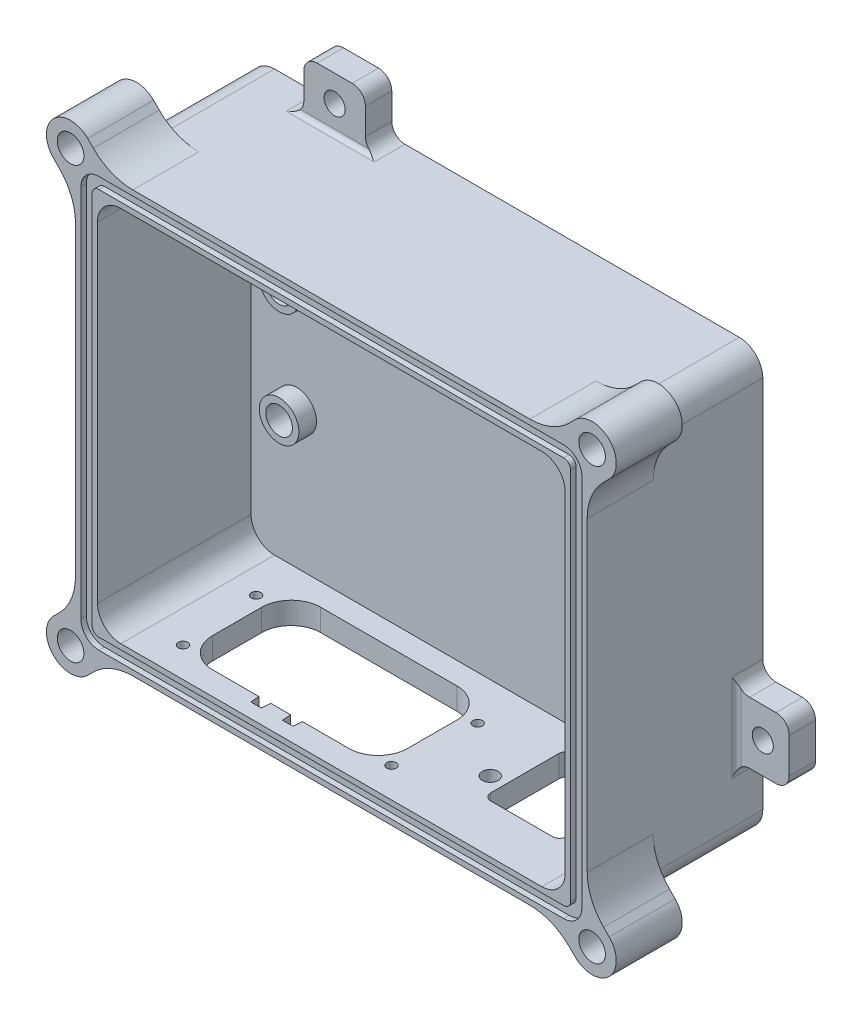
from build123d import *

# Parameters (mm, degrees)
SKETCH1_W                = 106.3625
SKETCH1_H                = 85.725
BOSS_EXTRUDE1_DEPTH      = 34.925
SHELL1_T                 = 5
FILLET1_R                = 5.334
CUT_EXTRUDE1_DEPTH       = 1.2446
BOSS_EXTRUDE2_DEPTH      = 15
SKETCH5_R                = 3.025
CUT_EXTRUDE4_DEPTH       = 8
FILLET2_R                = 12.7
CUT_EXTRUDE6_DEPTH       = 5
M3_CLEARANCE_HOLE1_D     = 3.6
M3_CLEARANCE_HOLE1_DEPTH = 5
M3_CLEARANCE_HOLE1_TIP   = 1.081549114
SKETCH18_R               = 4.5
SKETCH18_R_2             = 3.025
BOSS_EXTRUDE3_DEPTH      = 4
CUT_EXTRUDE7_START       = -1.5
SKETCH19_R               = 3.025
CUT_EXTRUDE7_DEPTH       = 1.5
SKETCH20_W               = 14
SKETCH20_H               = 12
SKETCH20_W_2             = 12
SKETCH20_H_2             = 14
BOSS_EXTRUDE4_DEPTH      = 6
M4_CLEARANCE_HOLE1_D     = 4.8
FILLET3_R                = 3
FILLET4_R                = 1


with BuildPart() as part:
    # Sketch1 → Boss-Extrude1 (new body)
    with BuildSketch(Plane.XY):
        Rectangle(SKETCH1_W, SKETCH1_H)
    extrude(amount=BOSS_EXTRUDE1_DEPTH)

    # Shell1
    shell1_openings = [part.faces().sort_by_distance(p)[0] for p in [
        (0, 0, 34.925),
    ]]
    offset(amount=SHELL1_T, openings=shell1_openings, kind=Kind.INTERSECTION)

    # Fillet1
    # the kernel refuses this fillet: 5.334 mm, written as the material it adds along each edge
    with BuildSketch(Plane(origin=(53.18125, -42.8625, 0), x_dir=(0, 1, 0), z_dir=(0, 0, 1)), Plane(origin=(53.18125, 42.8625, 0), x_dir=(-1, 0, 0), z_dir=(0, 0, 1)), Plane(origin=(-53.18125, -42.8625, 0), x_dir=(1, 0, 0), z_dir=(0, 0, 1))) as fillet1_piece_1:
        with BuildLine():
            CenterArc((FILLET1_R, FILLET1_R), FILLET1_R, 180, 90)
            Line((0, FILLET1_R), (0, 0))
            Line((0, 0), (FILLET1_R, 0))
        make_face()
    extrude(amount=34.925)
    with BuildSketch(Plane(origin=(-53.18125, 42.8625, 0), x_dir=(1, 0, 0), z_dir=(0, 0, 1))) as fillet1_piece_2:
        with BuildLine():
            CenterArc((FILLET1_R, -FILLET1_R), FILLET1_R, 90, 90)
            Line((0, -FILLET1_R), (0, 0))
            Line((0, 0), (FILLET1_R, 0))
        make_face()
    extrude(amount=34.925)
    # the kernel refuses this fillet: 5.334 mm, written as the material it takes off along each edge
    with BuildSketch(Plane(origin=(58.18125, -47.8625, 48.26), x_dir=(-1, 0, 0), z_dir=(0, 0, -1)), Plane(origin=(-58.18125, 47.8625, -18.335), x_dir=(0, -1, 0), z_dir=(0, 0, 1))) as fillet1_2_piece_1:
        with BuildLine():
            CenterArc((FILLET1_R, FILLET1_R), FILLET1_R, 180, 90)
            Line((0, FILLET1_R), (0, 0))
            Line((0, 0), (FILLET1_R, 0))
        make_face()
    extrude(amount=66.595, mode=Mode.SUBTRACT)
    with BuildSketch(Plane(origin=(-58.18125, -47.8625, 48.26), x_dir=(1, 0, 0), z_dir=(0, 0, -1)), Plane(origin=(58.18125, 47.8625, 48.26), x_dir=(-1, 0, 0), z_dir=(0, 0, -1))) as fillet1_2_piece_2:
        with BuildLine():
            CenterArc((FILLET1_R, -FILLET1_R), FILLET1_R, 90, 90)
            Line((0, -FILLET1_R), (0, 0))
            Line((0, 0), (FILLET1_R, 0))
        make_face()
    extrude(amount=66.595, mode=Mode.SUBTRACT)

    # Sketch2 → Cut-Extrude1 (cut)
    with BuildSketch(Plane.XY.offset(34.925)):
        with BuildLine():
            Line((-52.84725, -46.6452), (52.84725, -46.6452))
            ThreePointArc((52.84725, -46.6452), (55.758196486, -45.439446486), (56.96395, -42.5285))
            Line((56.96395, -42.5285), (56.96395, 42.5285))
            ThreePointArc((56.96395, 42.5285), (55.758196486, 45.439446486), (52.84725, 46.6452))
            Line((52.84725, 46.6452), (-52.84725, 46.6452))
            ThreePointArc((-52.84725, 46.6452), (-55.758196486, 45.439446486), (-56.96395, 42.5285))
            Line((-56.96395, 42.5285), (-56.96395, -42.5285))
            ThreePointArc((-56.96395, -42.5285), (-55.758196486, -45.439446486), (-52.84725, -46.6452))
        make_face()
        with BuildLine():
            Line((-54.39855, 42.5285), (-54.39855, -42.5285))
            ThreePointArc((-54.39855, -42.5285), (-53.94418475, -43.62543475), (-52.84725, -44.0798))
            Line((-52.84725, -44.0798), (52.84725, -44.0798))
            ThreePointArc((52.84725, -44.0798), (53.94418475, -43.62543475), (54.39855, -42.5285))
            Line((54.39855, -42.5285), (54.39855, 42.5285))
            ThreePointArc((54.39855, 42.5285), (53.94418475, 43.62543475), (52.84725, 44.0798))
            Line((52.84725, 44.0798), (-52.84725, 44.0798))
            ThreePointArc((-52.84725, 44.0798), (-53.94418475, 43.62543475), (-54.39855, 42.5285))
        make_face(mode=Mode.SUBTRACT)
    extrude(amount=-CUT_EXTRUDE1_DEPTH, mode=Mode.SUBTRACT)


with BuildPart() as body_2:
    # Sketch4 → Boss-Extrude2 (new body)
    with BuildSketch(Plane.XY.offset(34.925)):
        with BuildLine():
            ThreePointArc((56.618957571, -46.300207571), (54.888483428, -47.456473426), (52.84725, -47.8625))
            Line((52.84725, -47.8625), (50.403075407, -47.8625))
            Line((50.403075407, -47.8625), (55.404643096, -52.864067689))
            ThreePointArc((55.404643096, -52.864067689), (63.182817689, -52.864067689), (63.182817689, -45.085893096))
            Line((63.182817689, -45.085893096), (58.18125, -40.084325407))
            Line((58.18125, -40.084325407), (58.18125, -42.5285))
            ThreePointArc((58.18125, -42.5285), (57.775223426, -44.569733428), (56.618957571, -46.300207571))
        make_face()
    extrude(amount=-BOSS_EXTRUDE2_DEPTH)

    # Sketch5 → Cut-Extrude4 (cut)
    with BuildSketch(Plane.XY.offset(34.925)):
        with Locations((59.293730392, -48.974980392)):
            Circle(SKETCH5_R)
    extrude(amount=-CUT_EXTRUDE4_DEPTH, mode=Mode.SUBTRACT)


with BuildPart() as body_3:
    # Mirror3: mirrored copy
    add(body_2.part.mirror(Plane(origin=(0, 0, 0), x_dir=(0, 0, 1), z_dir=(1, 0, 0))))


with BuildPart() as body_4:
    # Mirror7: mirrored copy
    add(body_2.part.mirror(Plane.ZX))


with BuildPart() as body_5:
    # Mirror7 2: mirrored copy
    add(body_3.part.mirror(Plane.ZX))


with BuildPart() as part_1:
    add(part.part)

    # Combine3: union body 2, body 3, body 4, body 5
    add(body_2.part)
    add(body_3.part)
    add(body_4.part)
    add(body_5.part)

    # Fillet2
    fillet2_edges = [part_1.edges().sort_by_distance(p)[0] for p in [
        (58.18125, -40.084325407, 27.425),
        (50.403075407, -47.8625, 27.425),
        (-58.18125, -40.084325407, 27.425),
        (-50.403075407, -47.8625, 27.425),
        (58.18125, 40.084325407, 27.425),
        (50.403075407, 47.8625, 27.425),
        (-58.18125, 40.084325407, 27.425),
        (-50.403075407, 47.8625, 27.425),
    ]]
    fillet(fillet2_edges, radius=FILLET2_R)

    # Sketch13 → Cut-Extrude6 (cut)
    with BuildSketch(Plane.XZ.offset(47.8625)):
        with BuildLine():
            Line((39.20625, 23.847820577), (25.15625, 23.847820577))
            ThreePointArc((25.15625, 23.847820577), (24.02487915, 23.379191427), (23.55625, 22.247820577))
            Line((23.55625, 22.247820577), (23.55625, 6.697820577))
            ThreePointArc((23.55625, 6.697820577), (24.02487915, 5.566449727), (25.15625, 5.097820577))
            Line((25.15625, 5.097820577), (39.20625, 5.097820577))
            ThreePointArc((39.20625, 5.097820577), (40.33762085, 5.566449727), (40.80625, 6.697820577))
            Line((40.80625, 6.697820577), (40.80625, 22.247820577))
            ThreePointArc((40.80625, 22.247820577), (40.33762085, 23.379191427), (39.20625, 23.847820577))
        make_face()
        with BuildLine():
            Line((5.377332067, 11.727814626), (5.377332067, 22.927814626))
            add(Edge.make_bspline(
                [(5.377332067, 22.927814626), (5.377332067, 23.335905578), (5.306844409, 24.135752857), (4.834938107, 25.825161177), (3.55504026, 27.805522819), (1.574678619, 29.085420665), (-0.114729702, 29.557326967), (-0.914576981, 29.627814626), (-1.322667933, 29.627814626)],
                knots=[0, 0, 0, 0, 0.125, 0.25, 0.5, 0.75, 0.875, 1, 1, 1, 1], degree=3))
            Line((-1.322667933, 29.627814626), (-11.864502342, 29.627814626))
            Line((-11.864502342, 29.627814626), (-12.039479669, 31.627814796))
            Line((-12.039479669, 31.627814796), (-14.405856196, 31.627814796))
            Line((-14.405856196, 31.627814796), (-14.580833523, 29.627814626))
            Line((-14.580833523, 29.627814626), (-19.064502342, 29.627814626))
            Line((-19.064502342, 29.627814626), (-19.239479669, 31.627814796))
            Line((-19.239479669, 31.627814796), (-21.605856196, 31.627814796))
            Line((-21.605856196, 31.627814796), (-21.780833523, 29.627814626))
            Line((-21.780833523, 29.627814626), (-32.322667933, 29.627814626))
            add(Edge.make_bspline(
                [(-32.322667933, 29.627814626), (-32.730758885, 29.627814626), (-33.530606164, 29.557326967), (-35.220014484, 29.085420665), (-37.200376126, 27.805522819), (-38.480273972, 25.825161177), (-38.952180274, 24.135752857), (-39.022667933, 23.335905578), (-39.022667933, 22.927814626)],
                knots=[0, 0, 0, 0, 0.125, 0.25, 0.5, 0.75, 0.875, 1, 1, 1, 1], degree=3))
            Line((-39.022667933, 22.927814626), (-39.022667933, 11.727814626))
            add(Edge.make_bspline(
                [(-39.022667933, 11.727814626), (-39.022667933, 11.319723674), (-38.952180274, 10.519876395), (-38.480273972, 8.830468074), (-37.200376126, 6.850106433), (-35.220014484, 5.570208586), (-33.530606164, 5.098302284), (-32.730758885, 5.027814626), (-32.322667933, 5.027814626)],
                knots=[0, 0, 0, 0, 0.125, 0.25, 0.5, 0.75, 0.875, 1, 1, 1, 1], degree=3))
            Line((-32.322667933, 5.027814626), (-1.322667933, 5.027814626))
            add(Edge.make_bspline(
                [(-1.322667933, 5.027814626), (-0.914576981, 5.027814626), (-0.114729702, 5.098302284), (1.574678619, 5.570208586), (3.55504026, 6.850106433), (4.834938107, 8.830468074), (5.306844409, 10.519876395), (5.377332067, 11.319723674), (5.377332067, 11.727814626)],
                knots=[0, 0, 0, 0, 0.125, 0.25, 0.5, 0.75, 0.875, 1, 1, 1, 1], degree=3))
        make_face()
        with BuildLine():
            add(Edge.make_bspline(
                [(5.792332067, 28.127815468), (5.792332067, 30.297815468), (7.962332067, 30.297815468), (7.962332067, 28.127815468)],
                knots=[0, 0, 0, 0, 1, 1, 1, 1], degree=3, weights=[1, 0.333333333, 0.333333333, 1]))
            add(Edge.make_bspline(
                [(7.962332067, 28.127815468), (7.962332067, 25.957815468), (5.792332067, 25.957815468), (5.792332067, 28.127815468)],
                knots=[0, 0, 0, 0, 1, 1, 1, 1], degree=3, weights=[1, 0.333333333, 0.333333333, 1]))
        make_face()
        with BuildLine():
            add(Edge.make_bspline(
                [(9.462332067, 10.027815468), (9.462332067, 7.857815468), (7.292332067, 7.857815468), (7.292332067, 10.027815468)],
                knots=[0, 0, 0, 0, 1, 1, 1, 1], degree=3, weights=[1, 0.333333333, 0.333333333, 1]))
            add(Edge.make_bspline(
                [(7.292332067, 10.027815468), (7.292332067, 12.197815468), (9.462332067, 12.197815468), (9.462332067, 10.027815468)],
                knots=[0, 0, 0, 0, 1, 1, 1, 1], degree=3, weights=[1, 0.333333333, 0.333333333, 1]))
        make_face()
        with BuildLine():
            add(Edge.make_bspline(
                [(-39.437667933, 28.127815468), (-39.437667933, 25.957815468), (-41.607667933, 25.957815468), (-41.607667933, 28.127815468)],
                knots=[0, 0, 0, 0, 1, 1, 1, 1], degree=3, weights=[1, 0.333333333, 0.333333333, 1]))
            add(Edge.make_bspline(
                [(-41.607667933, 28.127815468), (-41.607667933, 30.297815468), (-39.437667933, 30.297815468), (-39.437667933, 28.127815468)],
                knots=[0, 0, 0, 0, 1, 1, 1, 1], degree=3, weights=[1, 0.333333333, 0.333333333, 1]))
        make_face()
        with BuildLine():
            add(Edge.make_bspline(
                [(-40.937667933, 10.027815468), (-40.937667933, 7.857815468), (-43.107667933, 7.857815468), (-43.107667933, 10.027815468)],
                knots=[0, 0, 0, 0, 1, 1, 1, 1], degree=3, weights=[1, 0.333333333, 0.333333333, 1]))
            add(Edge.make_bspline(
                [(-43.107667933, 10.027815468), (-43.107667933, 12.197815468), (-40.937667933, 12.197815468), (-40.937667933, 10.027815468)],
                knots=[0, 0, 0, 0, 1, 1, 1, 1], degree=3, weights=[1, 0.333333333, 0.333333333, 1]))
        make_face()
    extrude(amount=-CUT_EXTRUDE6_DEPTH, mode=Mode.SUBTRACT)

    # M3 Clearance Hole1
    with Locations(Plane(origin=(0, -47.8625, 0), x_dir=(-1, 0, 0), z_dir=(0, -1, 0))):
        with Locations((-20.18125, -18.972820577), (-44.18125, -9.972820577)):
            Hole(M3_CLEARANCE_HOLE1_D / 2, depth=M3_CLEARANCE_HOLE1_DEPTH)
            with Locations((0, 0, -(M3_CLEARANCE_HOLE1_DEPTH + M3_CLEARANCE_HOLE1_TIP / 2))):  # 118° drill point
                Cone(0, M3_CLEARANCE_HOLE1_D / 2, M3_CLEARANCE_HOLE1_TIP, mode=Mode.SUBTRACT)

    # Sketch18 → Boss-Extrude3 (add)
    # profile 1 of 4: a face of its own
    with BuildSketch(Plane.XY):
        with Locations((-42.802750334, 14.078501276)):
            Circle(SKETCH18_R)
        with Locations((-42.802750334, 14.078501276)):
            Circle(SKETCH18_R_2, mode=Mode.SUBTRACT)
    # profile 2 of 4: a face of its own
    with BuildSketch(Plane.XY):
        with Locations((-42.802750643, -11.829498724)):
            Circle(SKETCH18_R)
        with Locations((-42.802750643, -11.829498724)):
            Circle(SKETCH18_R_2, mode=Mode.SUBTRACT)
    # profile 3 of 4: a face of its own
    with BuildSketch(Plane.XY):
        with Locations((28.933249677, 14.98650042)):
            Circle(SKETCH18_R)
        with Locations((28.933249677, 14.98650042)):
            Circle(SKETCH18_R_2, mode=Mode.SUBTRACT)
    # profile 4 of 4: a face of its own
    with BuildSketch(Plane.XY):
        with Locations((28.933249344, -12.95349958)):
            Circle(SKETCH18_R)
        with Locations((28.933249344, -12.95349958)):
            Circle(SKETCH18_R_2, mode=Mode.SUBTRACT)
    extrude(amount=BOSS_EXTRUDE3_DEPTH)

    # Sketch19 → Cut-Extrude7 (cut)
    with BuildSketch(Plane.XY.offset(CUT_EXTRUDE7_START)):
        with Locations((28.933249677, 14.98650042)):
            Circle(SKETCH19_R)
        with Locations((28.933249344, -12.95349958)):
            Circle(SKETCH19_R)
        with Locations((-42.802750643, -11.829498724)):
            Circle(SKETCH19_R)
        with Locations((-42.802750334, 14.078501276)):
            Circle(SKETCH19_R)
    extrude(amount=CUT_EXTRUDE7_DEPTH, mode=Mode.SUBTRACT)

    # Sketch20 → Boss-Extrude4 (add)
    with BuildSketch(Plane(origin=(0, 0, -5), x_dir=(-1, 0, 0), z_dir=(0, 0, -1))):
        with Locations((33.18125, 53.8625)):
            Rectangle(SKETCH20_W, SKETCH20_H)
        with Locations((-64.18125, -22.8625)):
            Rectangle(SKETCH20_W_2, SKETCH20_H_2)
    extrude(amount=-BOSS_EXTRUDE4_DEPTH)

    # M4 Clearance Hole1 (through all)
    with Locations(Plane.XY.offset(1)):
        with Locations((-33.18125, 53.8625), (64.18125, -22.8625)):
            Hole(M4_CLEARANCE_HOLE1_D / 2)

    # Fillet3
    fillet3_edges = [part_1.edges().sort_by_distance(p)[0] for p in [
        (-40.18125, 59.8625, -2),
        (-40.18125, 47.8625, -2),
        (-26.18125, 47.8625, -2),
        (-26.18125, 59.8625, -2),
        (58.18125, -15.8625, -2),
        (58.18125, -29.8625, -2),
        (70.18125, -29.8625, -2),
        (70.18125, -15.8625, -2),
    ]]
    fillet(fillet3_edges, radius=FILLET3_R)

    # Fillet4
    fillet4_edges = [part_1.edges().sort_by_distance(p)[0] for p in [
        (-33.18125, 47.8625, 1),
        (58.18125, -22.8625, 1),
    ]]
    fillet(fillet4_edges, radius=FILLET4_R)


solid = part_1.part
